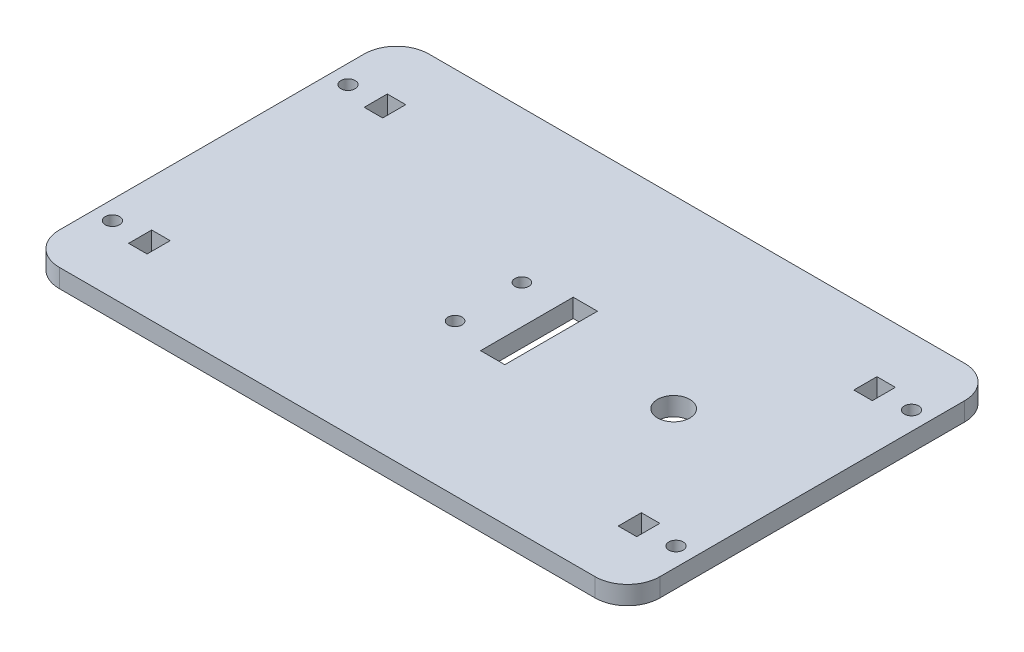
from build123d import *

# Parameters (mm, degrees)
SKETCH1_R           = 1.55
SKETCH1_R_2         = 1.5
SKETCH1_R_3         = 3.5
SKETCH1_W           = 5.253269852
SKETCH1_H           = 20.055
SKETCH1_W_2         = 4
SKETCH1_H_2         = 5
BOSS_EXTRUDE1_DEPTH = 4


with BuildPart() as part:
    # Sketch1 → Boss-Extrude1 (new body)
    with BuildSketch(Plane(origin=(0, 0, 0), x_dir=(1, 0, 0), z_dir=(0, 1, 0))):
        with BuildLine():
            Line((-58, -40), (58, -40))
            ThreePointArc((58, -40), (62.949747468, -37.949747468), (65, -33))
            Line((65, -33), (65, 33))
            ThreePointArc((65, 33), (62.949747468, 37.949747468), (58, 40))
            Line((58, 40), (-58, 40))
            ThreePointArc((-58, 40), (-62.949747468, 37.949747468), (-65, 33))
            Line((-65, 33), (-65, -33))
            ThreePointArc((-65, -33), (-62.949747468, -37.949747468), (-58, -40))
        make_face()
        with Locations((61, 25.5)):
            Circle(SKETCH1_R, mode=Mode.SUBTRACT)
        with Locations((61, -25.5)):
            Circle(SKETCH1_R, mode=Mode.SUBTRACT)
        with Locations((-61, -25.5)):
            Circle(SKETCH1_R, mode=Mode.SUBTRACT)
        with Locations((-61, 25.5)):
            Circle(SKETCH1_R, mode=Mode.SUBTRACT)
        with Locations((-5.1, -7.2275)):
            Circle(SKETCH1_R_2, mode=Mode.SUBTRACT)
        with Locations((-5.1, 7.2275)):
            Circle(SKETCH1_R_2, mode=Mode.SUBTRACT)
        with Locations((35, 0)):
            Circle(SKETCH1_R_3, mode=Mode.SUBTRACT)
        with Locations((5.848955237, 0)):
            Rectangle(SKETCH1_W, SKETCH1_H, mode=Mode.SUBTRACT)
        with Locations((53, -25.5)):
            Rectangle(SKETCH1_W_2, SKETCH1_H_2, mode=Mode.SUBTRACT)
        with Locations((53, 25.5)):
            Rectangle(SKETCH1_W_2, SKETCH1_H_2, mode=Mode.SUBTRACT)
        with Locations((-53, 25.5)):
            Rectangle(SKETCH1_W_2, SKETCH1_H_2, mode=Mode.SUBTRACT)
        with Locations((-53, -25.5)):
            Rectangle(SKETCH1_W_2, SKETCH1_H_2, mode=Mode.SUBTRACT)
    extrude(amount=BOSS_EXTRUDE1_DEPTH)


solid = part.part
